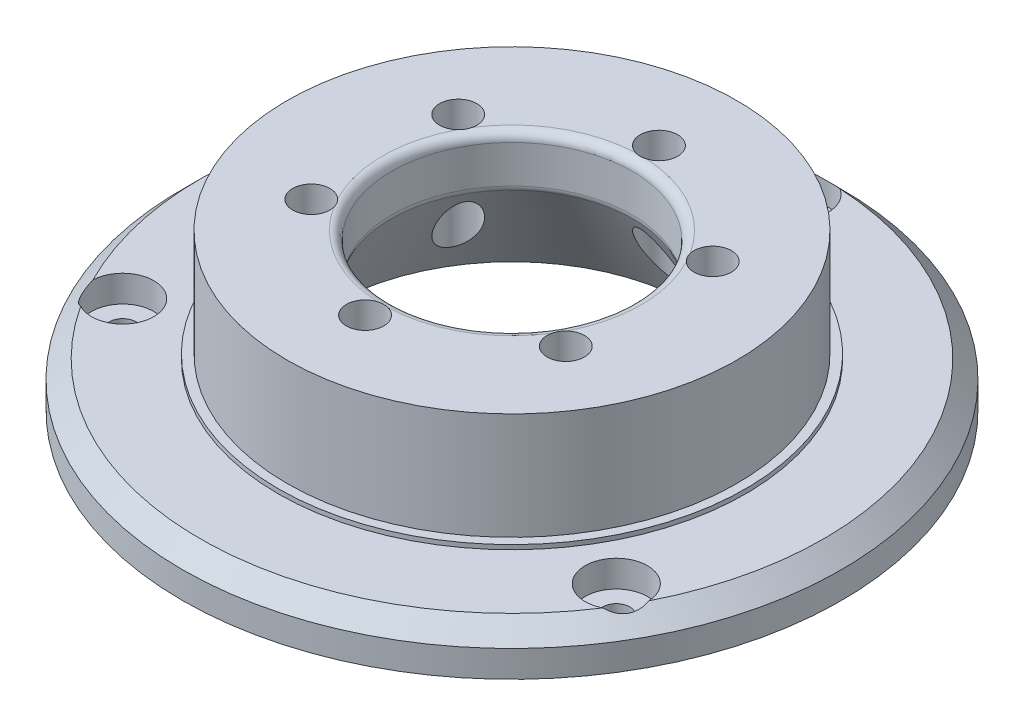
from build123d import *

# Parameters (mm, degrees)
SKETCH1_R           = 25.25
SKETCH1_R_2         = 13.5
BOSS_EXTRUDE1_DEPTH = 12.5
BOSS_EXTRUDE2_START = -5
SKETCH2_R           = 37
SKETCH2_R_2         = 13.5
BOSS_EXTRUDE2_DEPTH = 5
SKETCH3_R           = 1.5000000000000004
CUT_EXTRUDE1_DEPTH  = 54.79823417176441
CUT_EXTRUDE2_START  = -3
SKETCH4_R           = 3.500000000000001
CUT_EXTRUDE2_DEPTH  = 57.79823417176441
CIRPATTERN1_COUNT   = 3
CHAMFER1_SIZE       = 12
CHAMFER1_SIZE2      = 6.928203230275528
CHAMFER2_SIZE       = 2
SKETCH5_R           = 2.100000000000002
CUT_EXTRUDE3_DEPTH  = 56.174722607367954
CIRPATTERN2_COUNT   = 6
FILLET1_R           = 1
SKETCH6_R           = 26.250000000000004
SKETCH6_R_2         = 25.25
BOSS_EXTRUDE3_DEPTH = 0.5


with BuildPart() as part:
    # Sketch1 → Boss-Extrude1 (new body)
    with BuildSketch(Plane(origin=(0, 0, 0), x_dir=(1, 0, 0), z_dir=(0, 1, 0))):
        with Locations(Location((0, 0, 0), (0, 0, 270))):
            Circle(SKETCH1_R)
        with Locations(Location((0, 0, 0), (0, 0, 270))):
            Circle(SKETCH1_R_2, mode=Mode.SUBTRACT)
    extrude(amount=BOSS_EXTRUDE1_DEPTH)

    # Sketch2 → Boss-Extrude2 (add)
    with BuildSketch(Plane(origin=(0, 0, 0), x_dir=(1, 0, 0), z_dir=(0, 1, 0)).offset(BOSS_EXTRUDE2_START)):
        with Locations(Location((0, 0, 0), (0, 0, 270))):
            Circle(SKETCH2_R)
        with Locations(Location((0, 0, 0), (0, 0, 270))):
            Circle(SKETCH2_R_2, mode=Mode.SUBTRACT)
    extrude(amount=BOSS_EXTRUDE2_DEPTH)

    # Sketch3 → Cut-Extrude1 (cut, through all)
    with BuildSketch(Plane(origin=(0, 0, 0), x_dir=(1, 0, 0), z_dir=(0, 1, 0))):
        with Locations(Location((0, 32, 0), (0, 0, 270))):
            Circle(SKETCH3_R)
    cut_extrude1 = extrude(amount=-CUT_EXTRUDE1_DEPTH, mode=Mode.SUBTRACT)

    # Sketch4 → Cut-Extrude2 (cut)
    with BuildSketch(Plane(origin=(0, 0, 0), x_dir=(1, 0, 0), z_dir=(0, 1, 0)).offset(CUT_EXTRUDE2_START)):
        with Locations(Location((0, 32, 0), (0, 0, 270))):
            Circle(SKETCH4_R)
    cut_extrude2 = extrude(amount=CUT_EXTRUDE2_DEPTH, mode=Mode.SUBTRACT)

    # CirPattern1: Cut-Extrude1, Cut-Extrude2 ×3 about axis
    cirpattern1_axis = Axis((-1.23e-15, 0, 1.87e-15), (0, 1, 0))
    add([cut_extrude1.rotate(cirpattern1_axis, i * 360 / CIRPATTERN1_COUNT) for i in range(1, CIRPATTERN1_COUNT)], mode=Mode.SUBTRACT)
    add([cut_extrude2.rotate(cirpattern1_axis, i * 360 / CIRPATTERN1_COUNT) for i in range(1, CIRPATTERN1_COUNT)], mode=Mode.SUBTRACT)

    # Chamfer1
    chamfer1_edges = [part.edges().sort_by_distance(p)[0] for p in [
        (4.13e-15, -5, -13.5),
    ]]
    chamfer1_side = [part.faces().sort_by_distance(p)[0] for p in [
        (4.13e-15, 3.75, -13.5),
    ]]
    chamfer(chamfer1_edges, length=CHAMFER1_SIZE, length2=CHAMFER1_SIZE2, reference=chamfer1_side[0])

    # Chamfer2
    # the kernel refuses this chamfer: 2 mm, written as the material it takes off along each edge
    with BuildSketch(Plane(origin=(0, 0, 0), x_dir=(-1.8e-16, 0, 1), z_dir=(-1, 0, -1.8e-16))) as chamfer2_piece_1:
        Polygon((37, -CHAMFER2_SIZE), (37 - CHAMFER2_SIZE, 0), (37, 0), align=None)
    revolve(axis=Axis((0, 0, 0), (0, 1, 0)), mode=Mode.SUBTRACT)

    # Sketch5 → Cut-Extrude3 (cut, through all)
    with BuildSketch(Plane(origin=(0, 12.5, 0), x_dir=(1, 0, 0), z_dir=(0, 1, 0))):
        with Locations(Location((-6e-17, 16.5, 0), (0, 0, 270))):
            Circle(SKETCH5_R)
    cut_extrude3 = extrude(amount=-CUT_EXTRUDE3_DEPTH, mode=Mode.SUBTRACT)

    # CirPattern2: Cut-Extrude3 ×6 about axis
    cirpattern2_axis = Axis((-1.951e-14, 0, 4.7e-16), (0, 1, 0))
    for i in range(1, CIRPATTERN2_COUNT):
        add(cut_extrude3.rotate(cirpattern2_axis, i * 360 / CIRPATTERN2_COUNT), mode=Mode.SUBTRACT)

    # Fillet1
    # the kernel refuses this fillet: 1 mm, written as the material it takes off along each edge
    with BuildSketch(Plane(origin=(0, 7, 0), x_dir=(-1.8e-16, 0, 1), z_dir=(-1, 0, -1.8e-16))) as fillet1_piece_1:
        with BuildLine():
            CenterArc((13.5 + FILLET1_R, FILLET1_R * 0.267949192431), FILLET1_R, 180, 30.000000000000057)
            Line((13.5 + FILLET1_R * 0.133974596216, -FILLET1_R * 0.232050807569), (13.5, 0))
            Line((13.5, 0), (13.5, FILLET1_R * 0.267949192431))
        make_face()
    revolve(axis=Axis((0, 7, 0), (0, 1, 0)), mode=Mode.SUBTRACT)
    with BuildSketch(Plane(origin=(0, 12.5, 0), x_dir=(-1.8e-16, 0, 1), z_dir=(-1, 0, -1.8e-16))) as fillet1_piece_2:
        with BuildLine():
            CenterArc((13.5 + FILLET1_R, -FILLET1_R), FILLET1_R, 90, 90)
            Line((13.5 + FILLET1_R, 0), (13.5, 0))
            Line((13.5, 0), (13.5, -FILLET1_R))
        make_face()
    revolve(axis=Axis((0, 12.5, 0), (0, 1, 0)), mode=Mode.SUBTRACT)

    # Sketch6 → Boss-Extrude3 (add)
    with BuildSketch(Plane(origin=(0, 0, 0), x_dir=(1, 0, 0), z_dir=(0, 1, 0))):
        with Locations(Location((0, 0, 0), (0, 0, 270))):
            Circle(SKETCH6_R)
        with Locations(Location((0, 0, 0), (0, 0, 270))):
            Circle(SKETCH6_R_2, mode=Mode.SUBTRACT)
    extrude(amount=BOSS_EXTRUDE3_DEPTH)


solid = part.part
